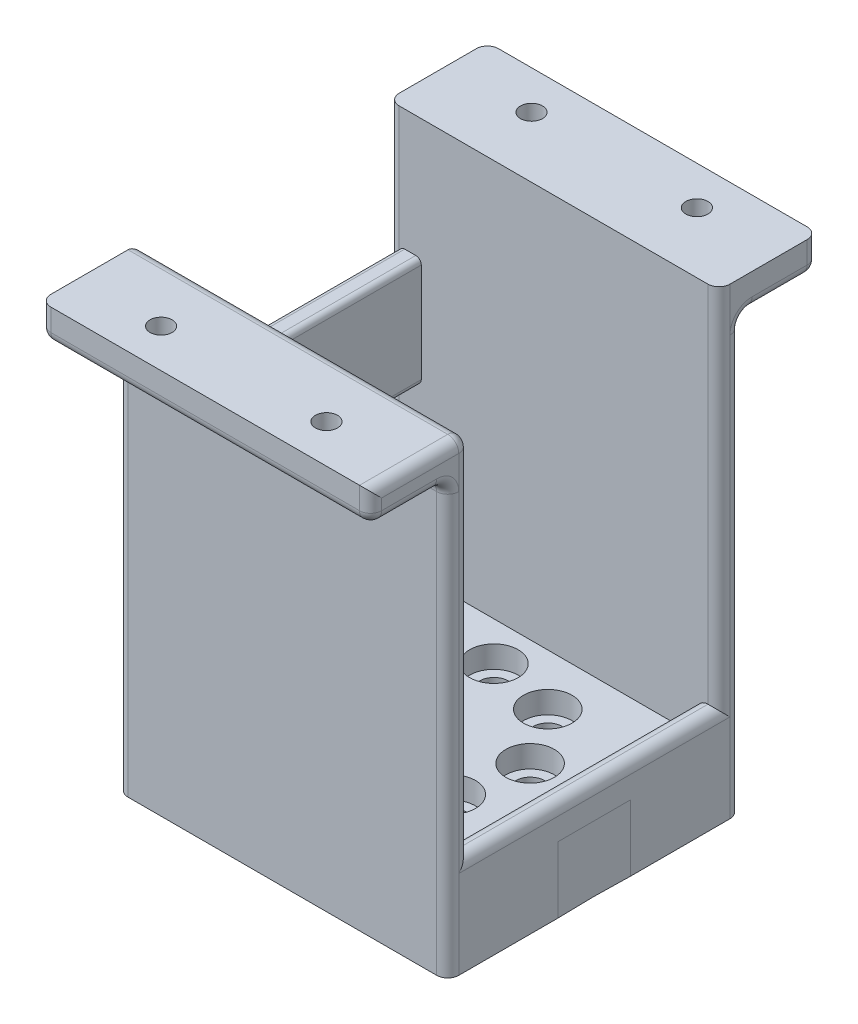
from build123d import *

# Parameters (mm, degrees)
SKETCH2_W                     = 30
SKETCH2_H                     = 26.6
BOSS_EXTRUDE1_DEPTH           = 25
SKETCH4_W                     = 30
SKETCH4_H                     = 3
BOSS_EXTRUDE2_DEPTH           = 31
SKETCH5_W                     = 30
SKETCH5_H                     = 3
BOSS_EXTRUDE3_DEPTH           = 7
F_2_0_2_DIAMETER_HOLE1_D      = 2
SKETCH10_W                    = 20.2
SKETCH10_H                    = 20.2
CUT_EXTRUDE1_DEPTH            = 20
F_5_0_5_DIAMETER_HOLE1_D      = 5
F_5_0_5_DIAMETER_HOLE2_D      = 5
CUT_EXTRUDE2_DEPTH            = 72.867656147
FILLET1_R                     = 1
SKETCH21_W                    = 30
SKETCH21_H                    = 26.6
CUT_EXTRUDE3_DEPTH            = 20
BOSS_EXTRUDE4_DEPTH           = 4
SKETCH26_R                    = 6
BOSS_EXTRUDE6_DEPTH           = 18
SKETCH27_R                    = 5
BOSS_EXTRUDE7_DEPTH           = 5
SKETCH28_R                    = 11
BOSS_EXTRUDE8_DEPTH           = 6
CBORE_FOR_M2_SHCS1_AT_2_COUNT = 2
CBORE_FOR_M2_SHCS1_AT_2_PITCH = 6.122934918
CBORE_FOR_M2_SHCS1_AT_3_COUNT = 2
CBORE_FOR_M2_SHCS1_AT_3_PITCH = 11.313708499
CBORE_FOR_M2_SHCS1_AT_4_COUNT = 2
CBORE_FOR_M2_SHCS1_AT_4_PITCH = 14.78207252
CBORE_FOR_M2_SHCS1_AT_5_COUNT = 2
CBORE_FOR_M2_SHCS1_AT_5_PITCH = 16
CBORE_FOR_M2_SHCS1_AT_6_COUNT = 2
CBORE_FOR_M2_SHCS1_AT_6_PITCH = 14.78207252
CBORE_FOR_M2_SHCS1_AT_7_COUNT = 2
CBORE_FOR_M2_SHCS1_AT_7_PITCH = 11.313708499
CBORE_FOR_M2_SHCS1_AT_8_COUNT = 2
CBORE_FOR_M2_SHCS1_AT_8_PITCH = 6.122934918
SKETCH49_R                    = 11
BOSS_EXTRUDE11_DEPTH          = 29
SKETCH50_W                    = 18
SKETCH50_H                    = 20
CUT_EXTRUDE9_DEPTH            = 72.867656266
SKETCH52_W                    = 16.573178866
SKETCH52_H                    = 20
CUT_EXTRUDE10_DEPTH           = 72.867656266
SKETCH53_R                    = 3.75
BOSS_EXTRUDE12_DEPTH          = 20
SKETCH54_R                    = 11
SKETCH54_R_2                  = 6
BOSS_EXTRUDE13_DEPTH          = 3
SKETCH55_R                    = 5.5
CUT_EXTRUDE11_DEPTH           = 3
SKETCH56_W                    = 26.6
SKETCH56_H                    = 32
CUT_EXTRUDE12_DEPTH           = 72.867656266
BOSS_EXTRUDE15_DEPTH          = 5
BOSS_EXTRUDE16_DEPTH          = 5
SKETCH60_W                    = 30
SKETCH60_H                    = 1
CUT_EXTRUDE13_DEPTH           = 36
SKETCH61_W                    = 2
SKETCH61_H                    = 22.6
BOSS_EXTRUDE17_DEPTH          = 3
FILLET8_R                     = 1
BOSS_EXTRUDE18_REACH          = 72.955
SKETCH62_W                    = 2
SKETCH62_H                    = 10
FILLET9_R                     = 0.5


with BuildPart() as part:
    # Sketch2 → Boss-Extrude1 (new body)
    with BuildSketch(Plane(origin=(0, 0, 0), x_dir=(1, 0, 0), z_dir=(0, 1, 0))):
        with Locations((15, 13.3)):
            Rectangle(SKETCH2_W, SKETCH2_H)
    extrude(amount=BOSS_EXTRUDE1_DEPTH)

    # Sketch4 → Boss-Extrude2 (add)
    with BuildSketch(Plane(origin=(0, 25, 0), x_dir=(1, 0, 0), z_dir=(0, 1, 0))):
        with Locations((15, 25.1)):
            Rectangle(SKETCH4_W, SKETCH4_H)
    boss_extrude2 = extrude(amount=BOSS_EXTRUDE2_DEPTH)

    # Sketch5 → Boss-Extrude3 (add)
    with BuildSketch(Plane(origin=(0, 0, -26.6), x_dir=(-1, 0, 0), z_dir=(0, 0, -1))):
        with Locations((-15, 54.5)):
            Rectangle(SKETCH5_W, SKETCH5_H)
    boss_extrude3 = extrude(amount=BOSS_EXTRUDE3_DEPTH)

    # Ø2.0 (2) Diameter Hole1 (through all)
    with Locations(Plane(origin=(0, 53, 0), x_dir=(-1, 0, 0), z_dir=(0, -1, 0))):
        with Locations((-22.5, 30.1), (-7.5, 30.1)):
            f_2_0_2_diameter_hole1 = Hole(F_2_0_2_DIAMETER_HOLE1_D / 2)

    # Mirror2: Boss-Extrude2, Boss-Extrude3, Ø2.0 (2) Diameter Hole1 across plane
    add(boss_extrude2.mirror(Plane.XY.offset(-13.3)))
    add(boss_extrude3.mirror(Plane.XY.offset(-13.3)))
    add(f_2_0_2_diameter_hole1.mirror(Plane.XY.offset(-13.3)), mode=Mode.SUBTRACT)

    # Sketch10 → Cut-Extrude1 (cut)
    with BuildSketch(Plane.XZ):
        with Locations((15, -13.3)):
            Rectangle(SKETCH10_W, SKETCH10_H)
    extrude(amount=-CUT_EXTRUDE1_DEPTH, mode=Mode.SUBTRACT)

    # Ø5.0 (5) Diameter Hole1 (through all)
    with Locations(Plane(origin=(0, 0, -26.6), x_dir=(-1, 0, 0), z_dir=(0, 0, -1))):
        with Locations((-15, 10)):
            Hole(F_5_0_5_DIAMETER_HOLE1_D / 2)

    # Ø5.0 (5) Diameter Hole2 (through all)
    with Locations(Plane(origin=(30, 0, 0), x_dir=(0, 0, -1), z_dir=(1, 0, 0))):
        with Locations((13.3, 10)):
            Hole(F_5_0_5_DIAMETER_HOLE2_D / 2)

    # Sketch14 → Cut-Extrude2 (cut, through all)
    with BuildSketch(Plane(origin=(30, 0, 0), x_dir=(0, 0, -1), z_dir=(1, 0, 0))):
        with BuildLine():
            Line((3, 25), (23.6, 25))
            ThreePointArc((23.6, 25), (13.3, 20.644164949), (3, 25))
        make_face()
    extrude(amount=-CUT_EXTRUDE2_DEPTH, mode=Mode.SUBTRACT)

    # Fillet1
    fillet1_edges = [part.edges().sort_by_distance(p)[0] for p in [
        (0, 20.644164949, -13.3),
        (30, 20.644164949, -13.3),
        (0, 40.5, -23.6),
        (30, 40.5, -23.6),
        (0, 26.5, -26.6),
        (30, 26.5, -26.6),
        (15, 53, -26.6),
        (30, 53, -30.1),
        (0, 53, -30.1),
        (30, 54.5, -33.6),
        (15, 53, -33.6),
        (0, 54.5, -33.6),
        (15, 0, -26.6),
        (0, 40.5, -3),
        (30, 56, 2),
        (30, 40.5, -3),
        (30, 0, -13.3),
        (15, 0, 0),
        (0, 0, -13.3),
        (30, 26.5, 0),
        (0, 26.5, 0),
        (30, 54.5, 7),
        (30, 53, 3.5),
        (0, 54.5, 7),
        (15, 53, 7),
        (0, 53, 3.5),
        (15, 53, 0),
        (4.9, 0, -13.3),
        (15, 0, -23.4),
        (25.1, 0, -13.3),
        (15, 0, -3.2),
    ]]
    fillet(fillet1_edges, radius=FILLET1_R)

    # Sketch21 → Cut-Extrude3 (cut)
    with BuildSketch(Plane.XZ):
        with Locations((15, -13.3)):
            Rectangle(SKETCH21_W, SKETCH21_H)
    extrude(amount=-CUT_EXTRUDE3_DEPTH, mode=Mode.SUBTRACT)

    # Sketch22 → Boss-Extrude4 (add)
    with BuildSketch(Plane.XZ.offset(-20)):
        with BuildLine():
            Line((30, -25.6), (30, -16.586589433))
            add(Edge.make_bspline(
                [(30, -16.586589433), (30, -16.042210126), (29.9806135, -15.496929185), (29.947797021, -14.406744617), (29.934775647, -13.861580973), (29.934496196, -13.179789366), (29.93516675, -13.040922925), (29.937892078, -12.76558201), (29.939945417, -12.627925453), (29.947832544, -12.214990537), (29.955450406, -11.939748084), (29.980239893, -11.114059681), (30, -10.563551364), (30, -10.013410567)],
                knots=[0, 0, 0, 0, 0.25, 0.25, 0.5, 0.5, 0.5625, 0.5625, 0.625, 0.625, 0.75, 0.75, 1, 1, 1, 1], degree=3))
            Line((30, -10.013410567), (30, -1))
            ThreePointArc((30, -1), (29.707106781, -0.292893219), (29, 0))
            Line((29, 0), (1, 0))
            ThreePointArc((1, 0), (0.292893219, -0.292893219), (0, -1))
            Line((0, -1), (0, -10.013410567))
            add(Edge.make_bspline(
                [(0, -10.013410567), (0, -10.557789874), (0.0193865, -11.103070815), (0.052202979, -12.193255383), (0.065224353, -12.738419027), (0.065503804, -13.420210634), (0.06483325, -13.559077075), (0.062107922, -13.83441799), (0.060054583, -13.972074547), (0.052167456, -14.385009463), (0.044549594, -14.660251916), (0.019760107, -15.485940319), (0, -16.036448636), (0, -16.586589433)],
                knots=[0, 0, 0, 0, 0.25, 0.25, 0.5, 0.5, 0.5625, 0.5625, 0.625, 0.625, 0.75, 0.75, 1, 1, 1, 1], degree=3))
            Line((0, -16.586589433), (0, -25.6))
            ThreePointArc((0, -25.6), (0.292893219, -26.307106781), (1, -26.6))
            Line((1, -26.6), (29, -26.6))
            ThreePointArc((29, -26.6), (29.707106781, -26.307106781), (30, -25.6))
        make_face()
    extrude(amount=BOSS_EXTRUDE4_DEPTH)

    # Sketch26 → Boss-Extrude6 (add)
    with BuildSketch(Plane.XZ.offset(-16)):
        with Locations(Location((14.75, -13.25, 0), (0, 0, 270))):
            Circle(SKETCH26_R)
    extrude(amount=BOSS_EXTRUDE6_DEPTH)

    # Sketch27 → Boss-Extrude7 (add)
    with BuildSketch(Plane.XZ.offset(2)):
        with Locations(Location((14.75, -13.25, 0), (0, 0, 270))):
            Circle(SKETCH27_R)
    extrude(amount=BOSS_EXTRUDE7_DEPTH)

    # Sketch28 → Boss-Extrude8 (add)
    with BuildSketch(Plane.XZ.offset(7)):
        with Locations(Location((14.75, -13.25, 0), (0, 0, 270))):
            Circle(SKETCH28_R)
    extrude(amount=BOSS_EXTRUDE8_DEPTH)

    # Sketch37 → CBORE for M2 SHCS1 (revolve, cut)
    with BuildSketch(Plane(origin=(8.052647165, -7, -17.625553109), x_dir=(0, 0, 1), z_dir=(1, 0, 0))):
        Polygon((0, 0), (0, 6), (1.3, 6), (1.3, 2), (2.2, 2), (2.2, 0), align=None)
    cbore_for_m2_shcs1 = revolve(axis=Axis((8.052647165, -0.65, -17.625553109), (0, -1, 0)), mode=Mode.SUBTRACT)

    # CBORE for M2 SHCS1 at 2: CBORE for M2 SHCS1 ×2
    with Locations(*[Vector(0.8256812413978046, 0, -0.5641369404708226) * (i * CBORE_FOR_M2_SHCS1_AT_2_PITCH) for i in range(1, CBORE_FOR_M2_SHCS1_AT_2_COUNT)]):
        add(cbore_for_m2_shcs1, mode=Mode.SUBTRACT)

    # CBORE for M2 SHCS1 at 3: CBORE for M2 SHCS1 ×2
    with Locations(*[Vector(0.978715860009591, 0, -0.20522004133535987) * (i * CBORE_FOR_M2_SHCS1_AT_3_PITCH) for i in range(1, CBORE_FOR_M2_SHCS1_AT_3_COUNT)]):
        add(cbore_for_m2_shcs1, mode=Mode.SUBTRACT)

    # CBORE for M2 SHCS1 at 4: CBORE for M2 SHCS1 ×2
    with Locations(*[Vector(0.9827498610154156, 0, 0.1849397487674874) * (i * CBORE_FOR_M2_SHCS1_AT_4_PITCH) for i in range(1, CBORE_FOR_M2_SHCS1_AT_4_COUNT)]):
        add(cbore_for_m2_shcs1, mode=Mode.SUBTRACT)

    # CBORE for M2 SHCS1 at 5: CBORE for M2 SHCS1 ×2
    with Locations(*[Vector(0.8371691043312223, 0, 0.5469441386039887) * (i * CBORE_FOR_M2_SHCS1_AT_5_PITCH) for i in range(1, CBORE_FOR_M2_SHCS1_AT_5_COUNT)]):
        add(cbore_for_m2_shcs1, mode=Mode.SUBTRACT)

    # CBORE for M2 SHCS1 at 6: CBORE for M2 SHCS1 ×2
    with Locations(*[Vector(0.56413694046925, 0, 0.8256812413988791) * (i * CBORE_FOR_M2_SHCS1_AT_6_PITCH) for i in range(1, CBORE_FOR_M2_SHCS1_AT_6_COUNT)]):
        add(cbore_for_m2_shcs1, mode=Mode.SUBTRACT)

    # CBORE for M2 SHCS1 at 7: CBORE for M2 SHCS1 ×2
    with Locations(*[Vector(0.20522004133536026, 0, 0.9787158600095909) * (i * CBORE_FOR_M2_SHCS1_AT_7_PITCH) for i in range(1, CBORE_FOR_M2_SHCS1_AT_7_COUNT)]):
        add(cbore_for_m2_shcs1, mode=Mode.SUBTRACT)

    # CBORE for M2 SHCS1 at 8: CBORE for M2 SHCS1 ×2
    with Locations(*[Vector(-0.18493974876935929, 0, 0.9827498610150633) * (i * CBORE_FOR_M2_SHCS1_AT_8_PITCH) for i in range(1, CBORE_FOR_M2_SHCS1_AT_8_COUNT)]):
        add(cbore_for_m2_shcs1, mode=Mode.SUBTRACT)

    # Sketch49 → Boss-Extrude11 (add)
    with BuildSketch(Plane.XZ.offset(-16)):
        with BuildLine():
            Line((30, -25.6), (30, -16.586589433))
            add(Edge.make_bspline(
                [(30, -16.586589433), (30, -16.042210126), (29.9806135, -15.496929185), (29.947797021, -14.406744617), (29.934775647, -13.861580973), (29.934496196, -13.179789366), (29.93516675, -13.040922925), (29.937892078, -12.76558201), (29.939945417, -12.627925453), (29.947832544, -12.214990537), (29.955450406, -11.939748084), (29.980239893, -11.114059681), (30, -10.563551364), (30, -10.013410567)],
                knots=[0, 0, 0, 0, 0.25, 0.25, 0.5, 0.5, 0.5625, 0.5625, 0.625, 0.625, 0.75, 0.75, 1, 1, 1, 1], degree=3))
            Line((30, -10.013410567), (30, -1))
            ThreePointArc((30, -1), (29.707106781, -0.292893219), (29, 0))
            Line((29, 0), (1, 0))
            ThreePointArc((1, 0), (0.292893219, -0.292893219), (0, -1))
            Line((0, -1), (0, -10.013410567))
            add(Edge.make_bspline(
                [(0, -10.013410567), (0, -10.557789874), (0.0193865, -11.103070815), (0.052202979, -12.193255383), (0.065224353, -12.738419027), (0.065503804, -13.420210634), (0.06483325, -13.559077075), (0.062107922, -13.83441799), (0.060054583, -13.972074547), (0.052167456, -14.385009463), (0.044549594, -14.660251916), (0.019760107, -15.485940319), (0, -16.036448636), (0, -16.586589433)],
                knots=[0, 0, 0, 0, 0.25, 0.25, 0.5, 0.5, 0.5625, 0.5625, 0.625, 0.625, 0.75, 0.75, 1, 1, 1, 1], degree=3))
            Line((0, -16.586589433), (0, -25.6))
            ThreePointArc((0, -25.6), (0.292893219, -26.307106781), (1, -26.6))
            Line((1, -26.6), (29, -26.6))
            ThreePointArc((29, -26.6), (29.707106781, -26.307106781), (30, -25.6))
        make_face()
        with Locations(Location((14.75, -13.25, 0), (0, 0, 270))):
            Circle(SKETCH49_R, mode=Mode.SUBTRACT)
    extrude(amount=BOSS_EXTRUDE11_DEPTH)

    # Sketch50 → Cut-Extrude9 (cut, through all)
    with BuildSketch(Plane(origin=(0, 0, -26.6), x_dir=(-1, 0, 0), z_dir=(0, 0, -1))):
        with Locations((-15, 3)):
            Rectangle(SKETCH50_W, SKETCH50_H)
    extrude(amount=-CUT_EXTRUDE9_DEPTH, mode=Mode.SUBTRACT)

    # Sketch52 → Cut-Extrude10 (cut, through all)
    with BuildSketch(Plane(origin=(30, 0, 0), x_dir=(0, 0, -1), z_dir=(1, 0, 0))):
        with Locations((13.3, 3)):
            Rectangle(SKETCH52_W, SKETCH52_H)
    extrude(amount=-CUT_EXTRUDE10_DEPTH, mode=Mode.SUBTRACT)

    # Sketch53 → Boss-Extrude12 (add)
    with BuildSketch(Plane.XZ.offset(-13)):
        with Locations(Location((14.75, -13.25, 0), (0, 0, 270))):
            Circle(SKETCH53_R)
    extrude(amount=BOSS_EXTRUDE12_DEPTH)

    # Sketch54 → Boss-Extrude13 (add)
    with BuildSketch(Plane.XZ.offset(-16)):
        with Locations((14.75, -13.25)):
            Circle(SKETCH54_R)
        with Locations((14.75, -13.25)):
            Circle(SKETCH54_R_2, mode=Mode.SUBTRACT)
    extrude(amount=BOSS_EXTRUDE13_DEPTH)

    # Sketch55 → Cut-Extrude11 (cut)
    with BuildSketch(Plane.XZ.offset(13)):
        with Locations(Location((14.75, -13.25, 0), (0, 0, 270))):
            Circle(SKETCH55_R)
    extrude(amount=-CUT_EXTRUDE11_DEPTH, mode=Mode.SUBTRACT)


with BuildPart() as body_2:
    # Split1: read off the stored shape, not the designer's step
    # Split1: the piece on the far side of the plane
    add(part.part)
    split(bisect_by=Plane(origin=(0, -7, 0), x_dir=(1, 0, 0), z_dir=(0, 1, 0)), keep=Keep.BOTTOM)


with BuildPart() as part_1:
    add(part.part)

    # Split1
    split(bisect_by=Plane(origin=(0, -7, 0), x_dir=(1, 0, 0), z_dir=(0, 1, 0)), keep=Keep.TOP)

    # Sketch56 → Cut-Extrude12 (cut, through all)
    with BuildSketch(Plane.ZY):
        with Locations((-13.3, 9)):
            Rectangle(SKETCH56_W, SKETCH56_H)
    extrude(amount=-CUT_EXTRUDE12_DEPTH, mode=Mode.SUBTRACT)


with BuildPart() as cut_extrude12_piece_1:
    # of the separate pieces the step leaves, piece 1, a body of its own (cut_extrude12_pieces)
    add(part_1.part.solids().sort_by_distance((1, 52, -26.6))[0])

    # Sketch57 → Boss-Extrude15 (add)
    with BuildSketch(Plane.XZ.offset(-25)):
        with BuildLine():
            Line((0, -24.6), (0, -25.6))
            ThreePointArc((0, -25.6), (0.292893219, -26.307106781), (1, -26.6))
            Line((1, -26.6), (29, -26.6))
            ThreePointArc((29, -26.6), (29.707106781, -26.307106781), (30, -25.6))
            Line((30, -25.6), (30, -24.6))
            ThreePointArc((30, -24.6), (29.707106781, -23.892893219), (29, -23.6))
            Line((29, -23.6), (1, -23.6))
            ThreePointArc((1, -23.6), (0.292893219, -23.892893219), (0, -24.6))
        make_face()
    extrude(amount=BOSS_EXTRUDE15_DEPTH)


with BuildPart() as cut_extrude12_piece_2:
    # of the separate pieces the step leaves, piece 2, a body of its own (cut_extrude12_pieces)
    add(part_1.part.solids().sort_by_distance((0, 52, -1))[0])

    # Sketch59 → Boss-Extrude16 (add)
    with BuildSketch(Plane.XZ.offset(-25)):
        with BuildLine():
            Line((1, -3), (29, -3))
            ThreePointArc((29, -3), (29.707106781, -2.707106781), (30, -2))
            Line((30, -2), (30, -1))
            ThreePointArc((30, -1), (29.707106781, -0.292893219), (29, 0))
            Line((29, 0), (1, 0))
            ThreePointArc((1, 0), (0.292893219, -0.292893219), (0, -1))
            Line((0, -1), (0, -2))
            ThreePointArc((0, -2), (0.292893219, -2.707106781), (1, -3))
        make_face()
    extrude(amount=BOSS_EXTRUDE16_DEPTH)


with BuildPart() as body_2_1:
    # Body-Move/Copy1: read off the stored shape, not the designer's step
    # Body-Move/Copy1: moved
    add(body_2.part.moved(Location((0, 27, 0))))

    # Combine3: union Cut-Extrude12 piece 1, Cut-Extrude12 piece 2
    add(cut_extrude12_piece_1.part)
    add(cut_extrude12_piece_2.part)

    # Sketch60 → Cut-Extrude13 (cut)
    with BuildSketch(Plane(origin=(0, 56, 0), x_dir=(1, 0, 0), z_dir=(0, 1, 0))):
        with Locations((15, 2.5)):
            Rectangle(SKETCH60_W, SKETCH60_H)
        with Locations((15, 24.1)):
            Rectangle(SKETCH60_W, SKETCH60_H)
    extrude(amount=-CUT_EXTRUDE13_DEPTH, mode=Mode.SUBTRACT)

    # Sketch61 → Boss-Extrude17 (add)
    with BuildSketch(Plane(origin=(0, 20, 0), x_dir=(1, 0, 0), z_dir=(0, 1, 0))):
        with Locations((1, 13.3)):
            Rectangle(SKETCH61_W, SKETCH61_H)
        with Locations((29, 13.3)):
            Rectangle(SKETCH61_W, SKETCH61_H)
    extrude(amount=BOSS_EXTRUDE17_DEPTH)

    # Fillet8
    fillet8_edges = [body_2_1.edges().sort_by_distance(p)[0] for p in [
        (14.5, 56, -2),
        (29.707106781, 55.707106781, -2),
        (30, 23, -13.3),
        (30, 39.5, -24.6),
        (30, 39, -2),
        (0, 39.5, -2),
        (0, 39.5, -24.6),
        (0, 23, -13.3),
        (2, 23, -13.3),
        (28, 23, -13.3),
    ]]
    fillet(fillet8_edges, radius=FILLET8_R - 0.0001)  # a hair under: the kernel refuses the full size

    # Boss-Extrude18: up to this face of the body (flat: up to its plane)
    boss_extrude18_end = Plane(body_2_1.part.faces().sort_by_distance((15, 38.09225259, -24.6))[0])
    # Sketch62 → Boss-Extrude18 (add, up to the picked face)
    with BuildSketch(Plane(origin=(0, 0, -2), x_dir=(-1, 0, 0), z_dir=(0, 0, -1)), mode=Mode.PRIVATE) as boss_extrude18_sk1:
        with Locations((-2, 40)):
            Rectangle(SKETCH62_W, SKETCH62_H)
    boss_extrude18_tool1 = split(extrude(boss_extrude18_sk1.sketch, amount=BOSS_EXTRUDE18_REACH, mode=Mode.PRIVATE), bisect_by=boss_extrude18_end, keep=Keep.BOTH, mode=Mode.PRIVATE)
    add(boss_extrude18_tool1.solids().sort_by(Axis((2, 40, -2), (0, 0, -1)))[0])

    # Fillet9
    fillet9_edges = [body_2_1.edges().sort_by_distance(p)[0] for p in [
        (1, 35, -13.3),
        (1, 45, -13.3),
        (3, 45, -13.3),
        (3, 35, -13.3),
    ]]
    fillet(fillet9_edges, radius=FILLET9_R)


solid = body_2_1.part
